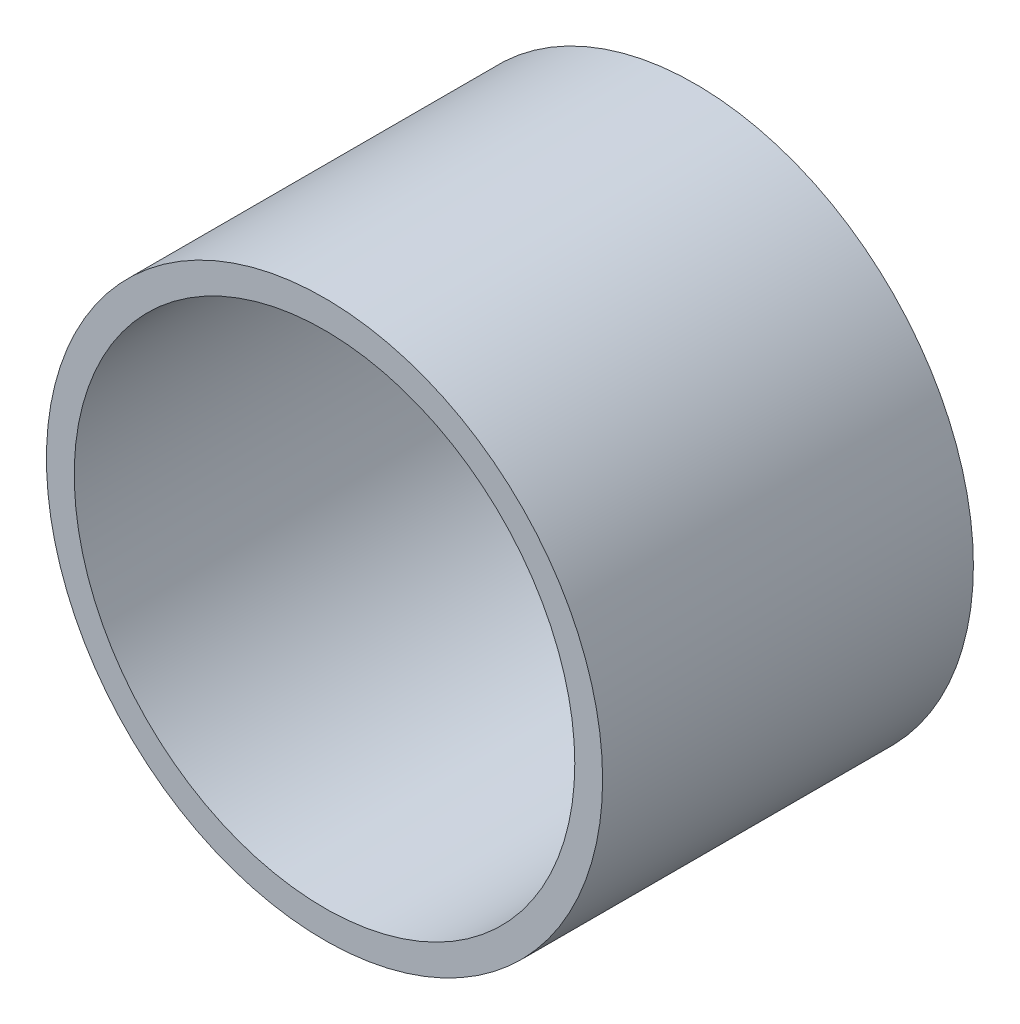
from build123d import *

# Parameters (mm, degrees)
SKETCH1_R           = 38.1
SKETCH1_R_2         = 34.29
BOSS_EXTRUDE1_DEPTH = 50.8


with BuildPart() as part:
    # Sketch1 → Boss-Extrude1 (new body)
    with BuildSketch(Plane.XY):
        Circle(SKETCH1_R)
        Circle(SKETCH1_R_2, mode=Mode.SUBTRACT)
    extrude(amount=BOSS_EXTRUDE1_DEPTH)


solid = part.part
